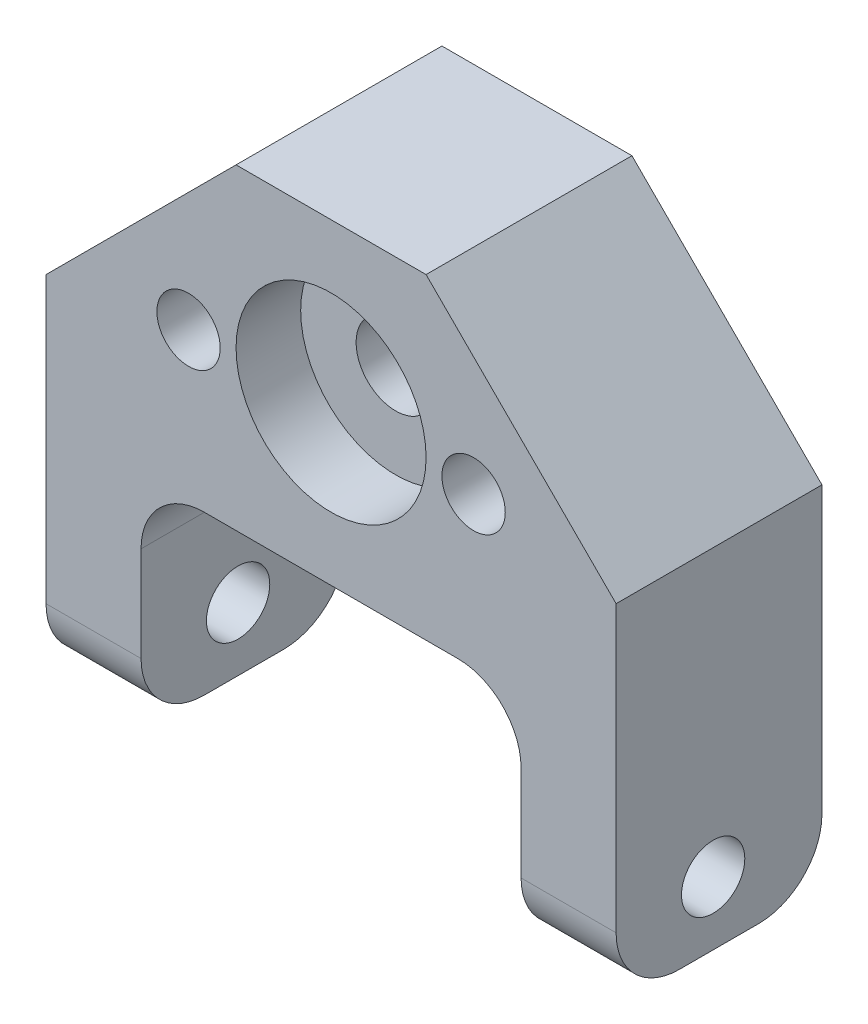
from build123d import *

# Parameters (mm, degrees)
SKETCH1_W                      = 57.15
SKETCH1_H                      = 31.75
BOSS_EXTRUDE1_DEPTH            = 20.6375
SKETCH2_R                      = 11.1125
CUT_EXTRUDE1_DEPTH             = 6.985
SKETCH3_R                      = 8.255
CUT_EXTRUDE2_DEPTH             = 2.413
SKETCH4_R                      = 3.96875
CUT_EXTRUDE3_DEPTH             = 35.56692943
CUT_EXTRUDE4_START             = -4.7625
SKETCH6_R                      = 9.525
CUT_EXTRUDE4_DEPTH             = 30.80442943
SKETCH7_W                      = 9.525
SKETCH7_H                      = 20.6375
BOSS_EXTRUDE2_DEPTH            = 22.225
SKETCH9_R                      = 3.175
CUT_EXTRUDE5_DEPTH             = 72.719166938
FILLET1_R                      = 6.35
F_1_4_0_2500_DOWEL_HOLE1_D     = 6.35
F_1_4_0_2500_DOWEL_HOLE1_DEPTH = 9.652
F_1_4_0_2500_DOWEL_HOLE1_TIP   = 1.907732465
FILLET3_R                      = 6.35
CHAMFER1_SIZE                  = 19.05


with BuildPart() as part:
    # Sketch1 → Boss-Extrude1 (new body)
    with BuildSketch(Plane.XY):
        Rectangle(SKETCH1_W, SKETCH1_H)
    extrude(amount=BOSS_EXTRUDE1_DEPTH)

    # Sketch2 → Cut-Extrude1 (cut)
    with BuildSketch(Plane(origin=(0, 0, 0), x_dir=(-1, 0, 0), z_dir=(0, 0, -1))):
        Circle(SKETCH2_R)
    extrude(amount=-CUT_EXTRUDE1_DEPTH, mode=Mode.SUBTRACT)

    # Sketch3 → Cut-Extrude2 (cut)
    with BuildSketch(Plane(origin=(0, 0, 6.985), x_dir=(-1, 0, 0), z_dir=(0, 0, -1))):
        Circle(SKETCH3_R)
    extrude(amount=-CUT_EXTRUDE2_DEPTH, mode=Mode.SUBTRACT)

    # Sketch4 → Cut-Extrude3 (cut, through all)
    with BuildSketch(Plane(origin=(0, 0, 9.398), x_dir=(-1, 0, 0), z_dir=(0, 0, -1))):
        Circle(SKETCH4_R)
    extrude(amount=-CUT_EXTRUDE3_DEPTH, mode=Mode.SUBTRACT)

    # Sketch6 → Cut-Extrude4 (cut, through all)
    with BuildSketch(Plane(origin=(0, 0, 9.398), x_dir=(-1, 0, 0), z_dir=(0, 0, -1)).offset(CUT_EXTRUDE4_START)):
        Circle(SKETCH6_R)
    extrude(amount=-CUT_EXTRUDE4_DEPTH, mode=Mode.SUBTRACT)

    # Sketch7 → Boss-Extrude2 (add)
    with BuildSketch(Plane.XZ.offset(15.875)):
        with Locations((-23.8125, 10.31875)):
            Rectangle(SKETCH7_W, SKETCH7_H)
        with Locations((23.8125, 10.31875)):
            Rectangle(SKETCH7_W, SKETCH7_H)
    extrude(amount=BOSS_EXTRUDE2_DEPTH)

    # Sketch9 → Cut-Extrude5 (cut, through all)
    with BuildSketch(Plane(origin=(28.575, 0, 0), x_dir=(0, 0, -1), z_dir=(1, 0, 0))):
        with Locations((-10.909520599, -31.75)):
            Circle(SKETCH9_R)
    extrude(amount=-CUT_EXTRUDE5_DEPTH, mode=Mode.SUBTRACT)

    # Fillet1
    fillet1_edges = [part.edges().sort_by_distance(p)[0] for p in [
        (19.05, -15.875, 10.31875),
        (-19.05, -15.875, 10.31875),
    ]]
    fillet(fillet1_edges, radius=FILLET1_R)

    # 1/4 (0.2500) Dowel Hole1
    with Locations(Plane.XY.offset(20.6375)):
        with Locations((-14.2875, -0.8255), (14.2875, -0.80518)):
            Hole(F_1_4_0_2500_DOWEL_HOLE1_D / 2, depth=F_1_4_0_2500_DOWEL_HOLE1_DEPTH)
            with Locations((0, 0, -(F_1_4_0_2500_DOWEL_HOLE1_DEPTH + F_1_4_0_2500_DOWEL_HOLE1_TIP / 2))):  # 118° drill point
                Cone(0, F_1_4_0_2500_DOWEL_HOLE1_D / 2, F_1_4_0_2500_DOWEL_HOLE1_TIP, mode=Mode.SUBTRACT)

    # Fillet3
    fillet3_edges = [part.edges().sort_by_distance(p)[0] for p in [
        (23.8125, -38.1, 0),
        (23.8125, -38.1, 20.6375),
        (-23.8125, -38.1, 20.6375),
        (-23.8125, -38.1, 0),
    ]]
    fillet(fillet3_edges, radius=FILLET3_R)

    # Chamfer1
    chamfer1_edges = [part.edges().sort_by_distance(p)[0] for p in [
        (28.575, 15.875, 10.31875),
        (-28.575, 15.875, 10.31875),
    ]]
    chamfer(chamfer1_edges, length=CHAMFER1_SIZE)


solid = part.part
